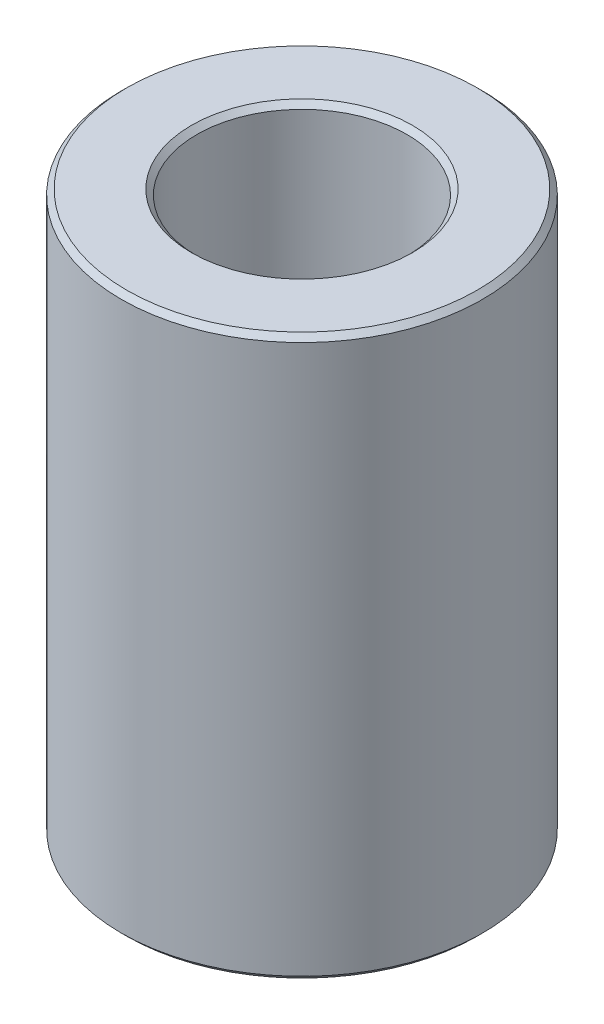
from build123d import *

# Parameters (mm, degrees)
SKETCH1_R           = 25
BOSS_EXTRUDE1_DEPTH = 77.447757708
SKETCH2_R           = 14.54907149
CUT_EXTRUDE1_DEPTH  = 86.136097949
CHAMFER1_SIZE       = 0.737116415


with BuildPart() as part:
    # Sketch1 → Boss-Extrude1 (new body)
    with BuildSketch(Plane(origin=(0, 0, 0), x_dir=(1, 0, 0), z_dir=(0, 1, 0))):
        Circle(SKETCH1_R)
    extrude(amount=BOSS_EXTRUDE1_DEPTH)

    # Sketch2 → Cut-Extrude1 (cut, through all)
    with BuildSketch(Plane(origin=(0, 0, 0), x_dir=(1, 0, 0), z_dir=(0, 1, 0))):
        Circle(SKETCH2_R)
    extrude(amount=CUT_EXTRUDE1_DEPTH, mode=Mode.SUBTRACT)

    # Chamfer1
    chamfer1_edges = [part.edges().sort_by_distance(p)[0] for p in [
        (-14.54907149, 77.447757708, 0),
        (-14.54907149, 0, 0),
        (-25, 0, 0),
        (-25, 77.447757708, 0),
    ]]
    chamfer(chamfer1_edges, length=CHAMFER1_SIZE)


solid = part.part
